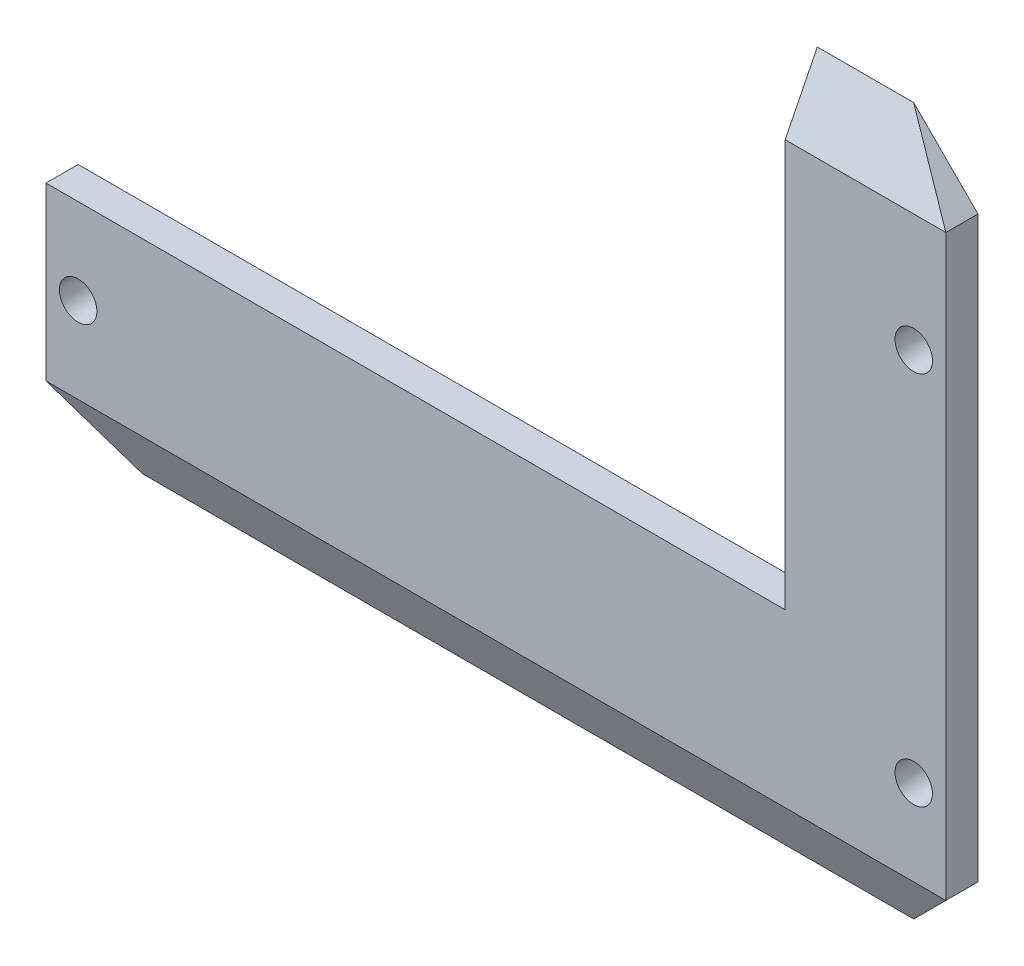
from build123d import *
from OCP.BRepFilletAPI import BRepFilletAPI_MakeChamfer

# Parameters (mm, degrees)
SKETCH1_W           = 84
SKETCH1_H           = 66
BOSS_EXTRUDE1_DEPTH = 3
CHAMFER2_SIZE       = 6
CHAMFER4_SIZE       = 3
CHAMFER4_SIZE_2     = 6
SKETCH2_R           = 1.75
CUT_EXTRUDE1_DEPTH  = 54.4976635
SKETCH3_W           = 69
SKETCH3_H           = 44
CUT_EXTRUDE2_DEPTH  = 10


with BuildPart() as part:
    # Sketch1 → Boss-Extrude1 (new body)
    with BuildSketch(Plane.XY):
        Rectangle(SKETCH1_W, SKETCH1_H)
    extrude(amount=BOSS_EXTRUDE1_DEPTH)

    # Chamfer2
    chamfer2_edges = [part.edges().sort_by_distance(p)[0] for p in [
        (42, -33, 1.5),
        (-42, -33, 1.5),
        (-42, 33, 1.5),
        (42, 33, 1.5),
    ]]
    chamfer(chamfer2_edges, length=CHAMFER2_SIZE)

    # Chamfer4
    chamfer4_edges_1 = [part.edges().sort_by_distance(p)[0] for p in [
        (0, -33, 3),
    ]]
    chamfer4_side_1 = [part.faces().sort_by_distance(p)[0] for p in [
        (0, -33, 2.94),
    ]]
    chamfer4_edges_2 = [part.edges().sort_by_distance(p)[0] for p in [
        (0, 33, 3),
    ]]
    chamfer4_side_2 = [part.faces().sort_by_distance(p)[0] for p in [
        (0, 32.94, 3),
    ]]
    chamfer4 = BRepFilletAPI_MakeChamfer(part.part.solid().wrapped)
    for e in chamfer4_edges_1:
        chamfer4.Add(CHAMFER4_SIZE - 0.0001, CHAMFER4_SIZE_2 - 0.0001, e.wrapped, chamfer4_side_1[0].wrapped)
    for e in chamfer4_edges_2:
        chamfer4.Add(CHAMFER4_SIZE_2 - 0.0001, CHAMFER4_SIZE - 0.0001, e.wrapped, chamfer4_side_2[0].wrapped)
    add(Compound.cast(chamfer4.Shape()), mode=Mode.REPLACE)  # a hair under: the kernel refuses the full size

    # Sketch2 → Cut-Extrude1 (cut, through all)
    with BuildSketch(Plane.XY.offset(3)):
        with Locations((-39, -19)):
            Circle(SKETCH2_R)
        with Locations(Location((39, -19, 0), (0, 0, 180))):
            Circle(SKETCH2_R)
        with Locations((39, 16)):
            Circle(SKETCH2_R)
        with Locations(Location((-39, 16, 0), (0, 0, 180))):
            Circle(SKETCH2_R)
    extrude(amount=-CUT_EXTRUDE1_DEPTH, mode=Mode.SUBTRACT)

    # Sketch3 → Cut-Extrude2 (cut)
    with BuildSketch(Plane.XY.offset(3)):
        with Locations((-7.5, 11)):
            Rectangle(SKETCH3_W, SKETCH3_H)
    extrude(amount=-CUT_EXTRUDE2_DEPTH, mode=Mode.SUBTRACT)


solid = part.part
